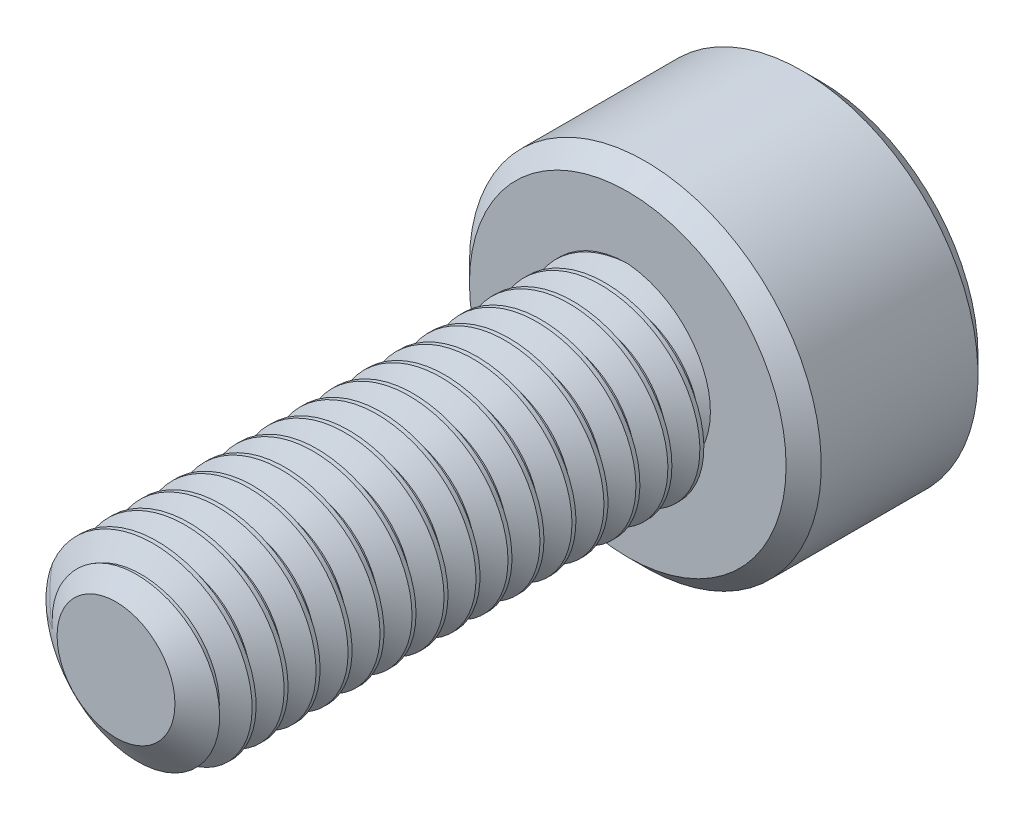
from build123d import *

# Parameters (mm, degrees)
SKETCH1_R          = 1.5
EXTRUDE1_DEPTH     = 8
CUT_SWEEP1_PITCH   = 0.5
SKETCH6_R          = 2.75
EXTRUDE2_DEPTH     = 3
CUT_EXTRUDE1_DEPTH = 1.875
CHAMFER1_SIZE      = 0.275


with BuildPart() as part:
    # Sketch1 → Extrude1 (new body)
    with BuildSketch(Plane.XY):
        Circle(SKETCH1_R)
    extrude(amount=-EXTRUDE1_DEPTH)

    # Cut-Sweep1: arcs per turn and ends read off the stored shape
    # Cut-Sweep1: the profile of Sketch3 profile screwed along a right-hand helix through 19 turns, 6 arcs to a turn; built about Z, then put on its axis
    cut_sweep1_z = Axis((0, 0, 0), (0, 0, 1))
    cut_sweep1_corners = [(1.5003, 0, -0.937673205), (1.175240474, 0, -0.75), (1.175240474, 0, -0.6875), (1.5003, 0, -0.499826795)]
    with BuildLine(mode=Mode.PRIVATE) as cut_sweep1_profile:
        Line(cut_sweep1_corners[0], cut_sweep1_corners[1])
        Line(cut_sweep1_corners[1], cut_sweep1_corners[2])
        Line(cut_sweep1_corners[2], cut_sweep1_corners[3])
        Line(cut_sweep1_corners[3], cut_sweep1_corners[0])
    cut_sweep1_cap = Face(cut_sweep1_profile.wire())
    cut_sweep1_turn_angles = [0, 30, 60, 90, 120, 150, 180, 210, 240, 270, 300, 330, 360]
    cut_sweep1_turn_weights = [1, 0.8660254037844387, 1, 0.8660254037844387, 1, 0.8660254037844387, 1, 0.8660254037844387, 1, 0.8660254037844387, 1, 0.8660254037844387, 1]
    cut_sweep1_turn_rails = [Edge.make_bspline([Vector(p[0], p[1], 0).rotate(cut_sweep1_z, cut_sweep1_turn_angles[k]) / cut_sweep1_turn_weights[k] + Vector(0, 0, p[2] + CUT_SWEEP1_PITCH * cut_sweep1_turn_angles[k] / 360) for k in range(13)], [0, 0, 0, 1, 1, 2, 2, 3, 3, 4, 4, 5, 5, 6, 6, 6], 2, cut_sweep1_turn_weights) for p in cut_sweep1_corners]
    cut_sweep1_turn_sides = [Face.make_surface_from_curves(cut_sweep1_turn_rails[p[0]], cut_sweep1_turn_rails[p[1]]) for p in [(0, 1), (1, 2), (2, 3), (3, 0)]]
    cut_sweep1 = Plane(origin=(0, 0, 0), x_dir=(0, 1, 0), z_dir=(0, 0, -1)) * Solid(Shell([*[p.moved(Location((0, 0, CUT_SWEEP1_PITCH * i))) for i in range(19) for p in cut_sweep1_turn_sides], cut_sweep1_cap, cut_sweep1_cap.rotate(cut_sweep1_z, 6840).moved(Location((0, 0, CUT_SWEEP1_PITCH * 6840 / 360)))]))
    add(cut_sweep1, mode=Mode.SUBTRACT)

    # Sketch4 → Cut-Revolve1 (revolve, cut)
    with BuildSketch(Plane(origin=(0, 0, 0), x_dir=(0, 0, -1), z_dir=(1, 0, 0)), mode=Mode.PRIVATE) as cut_revolve1_sk:
        Polygon((0.405251783, 1.5), (0, 0.921240474), (0, 1.5), align=None)
    revolve(cut_revolve1_sk.sketch.rotate(Axis((0, 0, 0), (0, 0, -1)), 263.352109169), axis=Axis((0, 0, 0), (0, 0, -1)), mode=Mode.SUBTRACT)

    # Sketch6 → Extrude2 (add)
    with BuildSketch(Plane(origin=(0, 0, -8), x_dir=(-1, 0, 0), z_dir=(0, 0, -1))):
        Circle(SKETCH6_R)
    extrude(amount=EXTRUDE2_DEPTH)

    # Sketch7 → Cut-Extrude1 (cut)
    with BuildSketch(Plane(origin=(0, 0, -11), x_dir=(-1, 0, 0), z_dir=(0, 0, -1))):
        Polygon((0, 1.443375673), (-1.25, 0.721687836), (-1.25, -0.721687836), (0, -1.443375673), (1.25, -0.721687836), (1.25, 0.721687836), align=None)
    extrude(amount=-CUT_EXTRUDE1_DEPTH, mode=Mode.SUBTRACT)

    # Cut-Extrude2 cone 1 section (through the dimple's axis) → Cut-Extrude2 (revolve, cut)
    with BuildSketch(Plane(origin=(0, 0, -11), x_dir=(0, 1, 0), z_dir=(1, 0, 0))):
        Polygon((0, 0), (1.443375673, 0), (0, 1.443375673), align=None)
    revolve(axis=Axis((0, 0, -11), (0, 0, 1)), mode=Mode.SUBTRACT)

    # Chamfer1
    chamfer1_edges = [part.edges().sort_by_distance(p)[0] for p in [
        (2.75, 0, -8),
        (2.75, 0, -11),
    ]]
    chamfer(chamfer1_edges, length=CHAMFER1_SIZE)


solid = part.part
